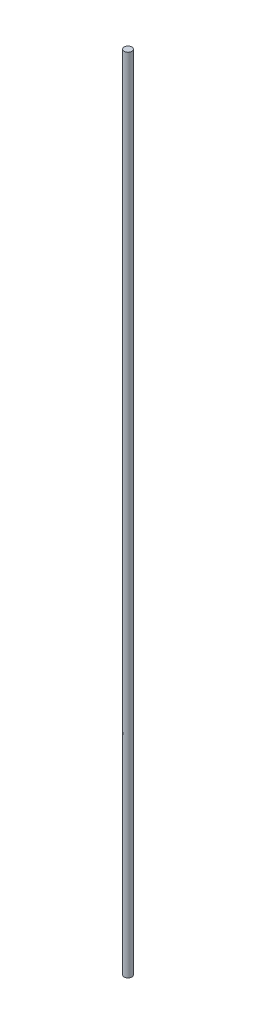
from build123d import *

# Parameters (mm, degrees)
SKETCH1_R           = 1.65
BOSS_EXTRUDE1_DEPTH = 344


with BuildPart() as part:
    # Sketch1 → Boss-Extrude1 (new body)
    with BuildSketch(Plane(origin=(0, 0, 0), x_dir=(1, 0, 0), z_dir=(0, 1, 0))):
        Circle(SKETCH1_R)
    extrude(amount=BOSS_EXTRUDE1_DEPTH)


solid = part.part
